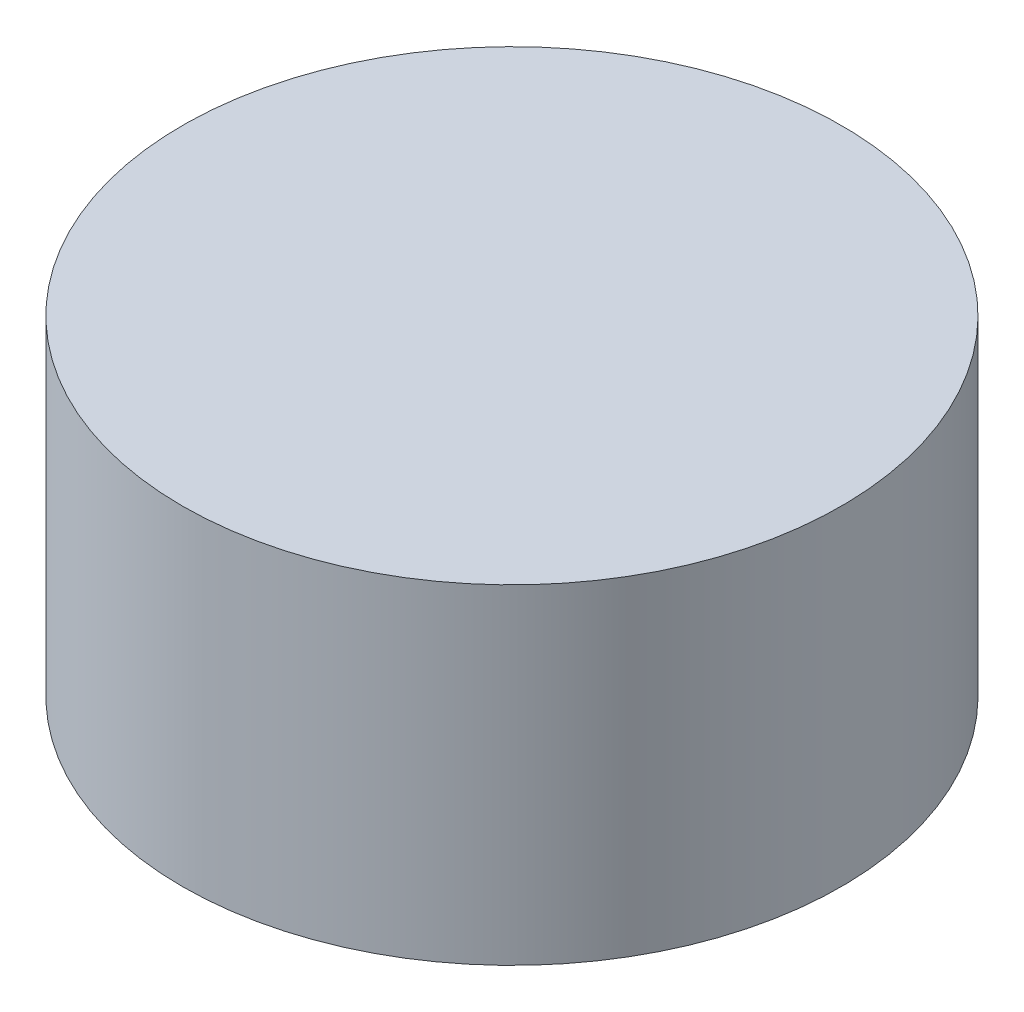
from build123d import *

# Parameters (mm, degrees)
SKETCH1_R           = 70
BOSS_EXTRUDE1_DEPTH = 70


with BuildPart() as part:
    # Sketch1 → Boss-Extrude1 (new body)
    with BuildSketch(Plane(origin=(0, 0, 0), x_dir=(1, 0, 0), z_dir=(0, 1, 0))):
        Circle(SKETCH1_R)
    extrude(amount=-BOSS_EXTRUDE1_DEPTH)


solid = part.part
